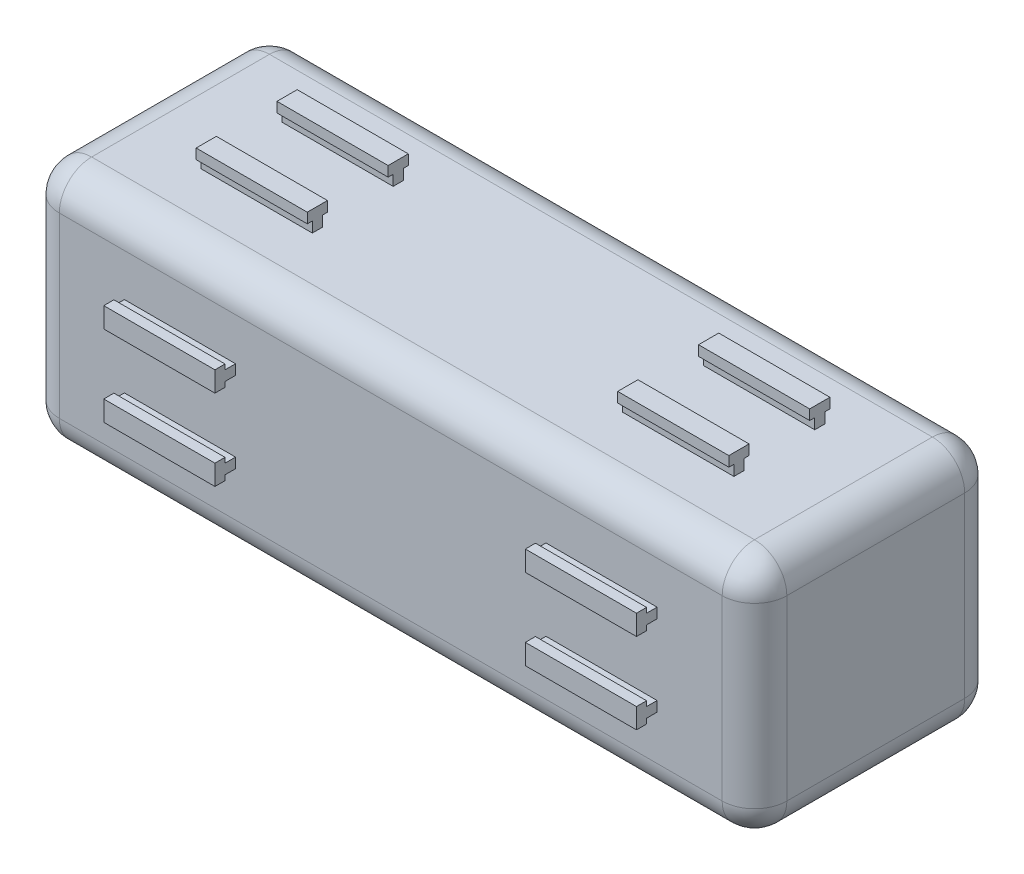
from build123d import *

# Parameters (mm, degrees)
BOSS_EXTRUDE1_DEPTH   = 13.75
BOSS_EXTRUDE1_2_DEPTH = 13.75
SKETCH1_W             = 180
SKETCH1_H             = 60
BOSS_EXTRUDE2_DEPTH   = 60
FILLET2_R             = 8
CIRPATTERN1_COUNT     = 4
MIRROR6_COPY_1_DEPTH  = 13.75
MIRROR6_COPY_2_DEPTH  = 13.75
MIRROR6_COPY_3_DEPTH  = 13.75
MIRROR6_COPY_4_DEPTH  = 13.75
MIRROR6_COPY_5_DEPTH  = 13.75
MIRROR6_COPY_6_DEPTH  = 13.75
MIRROR6_COPY_7_DEPTH  = 13.75
MIRROR6_COPY_8_DEPTH  = 13.75


with BuildPart() as part:
    # Sketch3 → Boss-Extrude1 (new, symmetric)
    with BuildSketch(Plane(origin=(52.15, 0, 0), x_dir=(0, 0, -1), z_dir=(1, 0, 0))):
        Polygon((-11, 0), (-11, 2.6), (-12.25, 2.6), (-12.25, 5.1), (-7.25, 5.1), (-7.25, 2.6), (-8.5, 2.6), (-8.5, 0), align=None)
    boss_extrude1 = extrude(amount=BOSS_EXTRUDE1_DEPTH, both=True)



with BuildPart() as body_2:
    # Sketch3 → Boss-Extrude1 2 (new, symmetric)
    with BuildSketch(Plane(origin=(52.15, 0, 0), x_dir=(0, 0, -1), z_dir=(1, 0, 0))):
        Polygon((9, 0), (11.5, 0), (11.5, 2.6), (12.75, 2.6), (12.75, 5.1), (7.75, 5.1), (7.75, 2.6), (9, 2.6), align=None)
    boss_extrude1_2 = extrude(amount=BOSS_EXTRUDE1_2_DEPTH, both=True)


with BuildPart() as part_1:
    add(part.part)

    add(body_2.part)  # Boss-Extrude2 merges body 2
    # Sketch1 → Boss-Extrude2 (add)
    with BuildSketch(Plane(origin=(0, 0, 0), x_dir=(1, 0, 0), z_dir=(0, 1, 0))):
        Rectangle(SKETCH1_W, SKETCH1_H)
    extrude(amount=-BOSS_EXTRUDE2_DEPTH)

    # Fillet2
    fillet2_edges = [part_1.edges().sort_by_distance(p)[0] for p in [
        (-90, -60, 0),
        (-90, 0, 0),
        (-90, -30, -30),
        (0, -60, -30),
        (0, 0, -30),
        (90, -30, -30),
        (90, -60, 0),
        (90, 0, 0),
        (90, -30, 30),
        (0, -60, 30),
        (-90, -30, 30),
        (0, 0, 30),
    ]]
    fillet(fillet2_edges, radius=FILLET2_R)

    # CirPattern1: Boss-Extrude1, Boss-Extrude1 2 ×4 about axis
    cirpattern1_axis = Axis((90, -30, 0), (1, 0, 0))
    add([boss_extrude1.rotate(cirpattern1_axis, i * 360 / CIRPATTERN1_COUNT) for i in range(1, CIRPATTERN1_COUNT)])
    add([boss_extrude1_2.rotate(cirpattern1_axis, i * 360 / CIRPATTERN1_COUNT) for i in range(1, CIRPATTERN1_COUNT)])

    # Mirror6 copy 1 sketch → Mirror6 copy 1 (add, symmetric)
    with BuildSketch(Plane(origin=(-52.15, -30, 30), x_dir=(0, 1, 0), z_dir=(-1, 0, 0))):
        Polygon((-11, 0), (-11, -2.6), (-12.25, -2.6), (-12.25, -5.1), (-7.25, -5.1), (-7.25, -2.6), (-8.5, -2.6), (-8.5, 0), align=None)
    extrude(amount=MIRROR6_COPY_1_DEPTH, both=True)

    # Mirror6 copy 2 sketch → Mirror6 copy 2 (add, symmetric)
    with BuildSketch(Plane(origin=(-52.15, -60, 0), x_dir=(0, 0, 1), z_dir=(-1, 0, 0))):
        Polygon((-11, 0), (-11, -2.6), (-12.25, -2.6), (-12.25, -5.1), (-7.25, -5.1), (-7.25, -2.6), (-8.5, -2.6), (-8.5, 0), align=None)
    extrude(amount=MIRROR6_COPY_2_DEPTH, both=True)

    # Mirror6 copy 3 sketch → Mirror6 copy 3 (add, symmetric)
    with BuildSketch(Plane(origin=(-52.15, -30, -30), x_dir=(0, -1, 0), z_dir=(-1, 0, 0))):
        Polygon((-11, 0), (-11, -2.6), (-12.25, -2.6), (-12.25, -5.1), (-7.25, -5.1), (-7.25, -2.6), (-8.5, -2.6), (-8.5, 0), align=None)
    extrude(amount=MIRROR6_COPY_3_DEPTH, both=True)

    # Mirror6 copy 4 sketch → Mirror6 copy 4 (add, symmetric)
    with BuildSketch(Plane(origin=(-52.15, -30, 30), x_dir=(0, 1, 0), z_dir=(-1, 0, 0))):
        Polygon((9, 0), (11.5, 0), (11.5, -2.6), (12.75, -2.6), (12.75, -5.1), (7.75, -5.1), (7.75, -2.6), (9, -2.6), align=None)
    extrude(amount=MIRROR6_COPY_4_DEPTH, both=True)

    # Mirror6 copy 5 sketch → Mirror6 copy 5 (add, symmetric)
    with BuildSketch(Plane(origin=(-52.15, -60, 0), x_dir=(0, 0, 1), z_dir=(-1, 0, 0))):
        Polygon((9, 0), (11.5, 0), (11.5, -2.6), (12.75, -2.6), (12.75, -5.1), (7.75, -5.1), (7.75, -2.6), (9, -2.6), align=None)
    extrude(amount=MIRROR6_COPY_5_DEPTH, both=True)

    # Mirror6 copy 6 sketch → Mirror6 copy 6 (add, symmetric)
    with BuildSketch(Plane(origin=(-52.15, -30, -30), x_dir=(0, -1, 0), z_dir=(-1, 0, 0))):
        Polygon((9, 0), (11.5, 0), (11.5, -2.6), (12.75, -2.6), (12.75, -5.1), (7.75, -5.1), (7.75, -2.6), (9, -2.6), align=None)
    extrude(amount=MIRROR6_COPY_6_DEPTH, both=True)

    # Mirror6 copy 7 sketch → Mirror6 copy 7 (add, symmetric)
    with BuildSketch(Plane(origin=(-52.15, 0, 0), x_dir=(0, 0, -1), z_dir=(-1, 0, 0))):
        Polygon((-11, 0), (-11, -2.6), (-12.25, -2.6), (-12.25, -5.1), (-7.25, -5.1), (-7.25, -2.6), (-8.5, -2.6), (-8.5, 0), align=None)
    extrude(amount=MIRROR6_COPY_7_DEPTH, both=True)

    # Mirror6 copy 8 sketch → Mirror6 copy 8 (add, symmetric)
    with BuildSketch(Plane(origin=(-52.15, 0, 0), x_dir=(0, 0, -1), z_dir=(-1, 0, 0))):
        Polygon((9, 0), (11.5, 0), (11.5, -2.6), (12.75, -2.6), (12.75, -5.1), (7.75, -5.1), (7.75, -2.6), (9, -2.6), align=None)
    extrude(amount=MIRROR6_COPY_8_DEPTH, both=True)


solid = part_1.part
